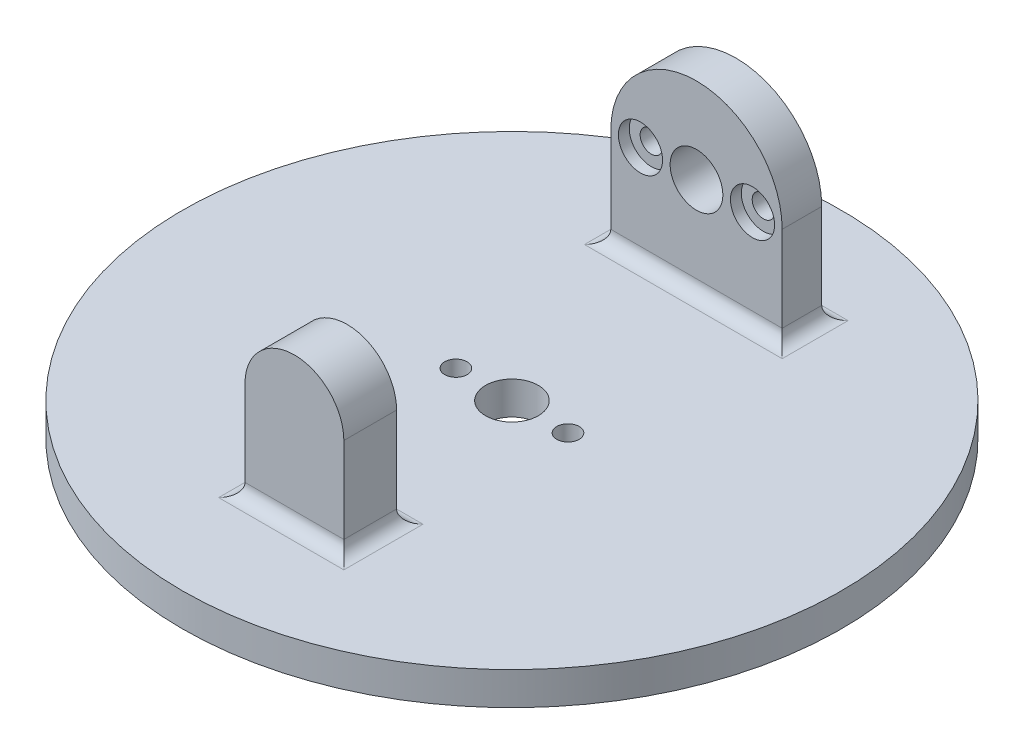
from build123d import *

# Parameters (mm, degrees)
SKETCH1_R                       = 50
SKETCH1_R_2                     = 4
BOSS_EXTRUDE1_DEPTH             = 5
BOSS_EXTRUDE4_DEPTH             = 6
BOSS_EXTRUDE5_DEPTH             = 8
CBORE_FOR_M3_SBHCS1_D           = 3.4
CBORE_FOR_M3_SBHCS1_CBORE_D     = 6.7
CBORE_FOR_M3_SBHCS1_CBORE_DEPTH = 1.65
CBORE_START                     = -29.65
CBORE_FOR_M3_SBHCS2_OUTLINE_R   = 3.35
CBORE_FOR_M3_SBHCS2_DEPTH       = 1.65
CBORE_START_2                   = -34
CBORE_FOR_M3_SBHCS2_2_OUTLINE_R = 1.7
CBORE_FOR_M3_SBHCS2_2_DEPTH     = 4.35
SKETCH29_R                      = 4
CUT_EXTRUDE1_DEPTH              = 6
SKETCH30_R                      = 5.25
CUT_EXTRUDE2_DEPTH              = 4
FILLET1_R                       = 2


# Read off the part's stored shape, not the designer's step: CBORE for M3 SBHCS2
with BuildPart() as part:
    # Sketch1 → Boss-Extrude1 (new body)
    with BuildSketch(Plane(origin=(0, 0, 0), x_dir=(1, 0, 0), z_dir=(0, 1, 0))):
        with Locations(Location((0, 0, 0), (0, 0, 270))):
            Circle(SKETCH1_R)
        with Locations(Location((0, 0, 0), (0, 0, 270))):
            Circle(SKETCH1_R_2, mode=Mode.SUBTRACT)
    extrude(amount=BOSS_EXTRUDE1_DEPTH)

    # Sketch2 → Boss-Extrude4 (add)
    with BuildSketch(Plane.XY.offset(-28)):
        with BuildLine():
            Line((-13, 5), (-13, 20))
            ThreePointArc((-13, 20), (0, 33), (13, 20))
            Line((13, 20), (13, 5))
            Line((13, 5), (-13, 5))
        make_face()
    extrude(amount=-BOSS_EXTRUDE4_DEPTH)

    # Sketch24 → Boss-Extrude5 (add)
    with BuildSketch(Plane.XY.offset(33)):
        with BuildLine():
            Line((-7.5, 5), (-7.5, 20))
            ThreePointArc((-7.5, 20), (0, 27.5), (7.5, 20))
            Line((7.5, 20), (7.5, 5))
            Line((7.5, 5), (-7.5, 5))
        make_face()
    extrude(amount=-BOSS_EXTRUDE5_DEPTH)

    # CBORE for M3 SBHCS1 (through all)
    with Locations(Plane(origin=(0, 0, 0), x_dir=(-1, 0, 0), z_dir=(0, -1, 0))):
        with Locations((-8.5, 0), (8.5, 0)):
            CounterBoreHole(CBORE_FOR_M3_SBHCS1_D / 2, CBORE_FOR_M3_SBHCS1_CBORE_D / 2, CBORE_FOR_M3_SBHCS1_CBORE_DEPTH)

    # CBORE for M3 SBHCS2 outline → CBORE for M3 SBHCS2 (cut)
    with BuildSketch(Plane.XY.offset(CBORE_START)):
        with Locations((-8.5, 20)):
            Circle(CBORE_FOR_M3_SBHCS2_OUTLINE_R)
        with Locations((8.5, 20)):
            Circle(CBORE_FOR_M3_SBHCS2_OUTLINE_R)
    extrude(amount=CBORE_FOR_M3_SBHCS2_DEPTH, mode=Mode.SUBTRACT)

    # CBORE for M3 SBHCS2 2 outline → CBORE for M3 SBHCS2 2 (cut)
    with BuildSketch(Plane.XY.offset(CBORE_START_2)):
        with Locations((-8.5, 20)):
            Circle(CBORE_FOR_M3_SBHCS2_2_OUTLINE_R)
        with Locations((8.5, 20)):
            Circle(CBORE_FOR_M3_SBHCS2_2_OUTLINE_R)
    extrude(amount=CBORE_FOR_M3_SBHCS2_2_DEPTH, mode=Mode.SUBTRACT)

    # Sketch29 → Cut-Extrude1 (cut)
    with BuildSketch(Plane.XY.offset(-28)):
        with Locations((0, 20)):
            Circle(SKETCH29_R)
    extrude(amount=-CUT_EXTRUDE1_DEPTH, mode=Mode.SUBTRACT)

    # Sketch30 → Cut-Extrude2 (cut)
    with BuildSketch(Plane(origin=(0, 0, 25), x_dir=(-1, 0, 0), z_dir=(0, 0, -1))):
        with Locations((0, 19.924351103)):
            Circle(SKETCH30_R)
    extrude(amount=-CUT_EXTRUDE2_DEPTH, mode=Mode.SUBTRACT)

    # Fillet1
    fillet1_edges = [part.edges().sort_by_distance(p)[0] for p in [
        (0, 5, -34),
        (13, 5, -31),
        (-13, 5, -31),
        (0, 5, -28),
        (0, 5, 25),
        (7.5, 5, 29),
        (-7.5, 5, 29),
        (0, 5, 33),
    ]]
    fillet(fillet1_edges, radius=FILLET1_R)


solid = part.part
